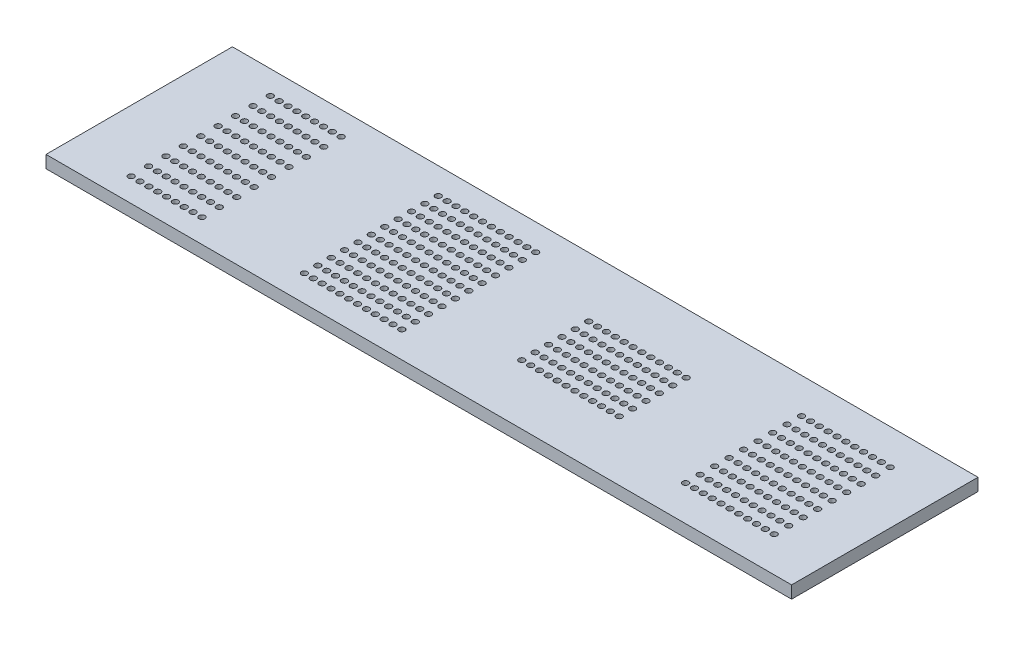
from build123d import *

# Parameters (mm, degrees)
ESQUISSE2_W                     = 120
ESQUISSE2_H                     = 30
BOSS_EXTRU_1_DEPTH              = 2
ENL_V_MAT_EXTRU_3_REACH         = 63.879
ESQUISSE8_R                     = 0.475
R_P_TITION_LIN_AIRE4_COUNT      = 9
R_P_TITION_LIN_AIRE4_PITCH      = 1.424
R_P_TITION_LIN_AIRE4_COUNT_DIR2 = 9
R_P_TITION_LIN_AIRE4_PITCH_DIR2 = 2.8
ENL_V_MAT_EXTRU_4_REACH         = 63.879
ESQUISSE10_R                    = 0.475
R_P_TITION_LIN_AIRE5_COUNT      = 12
R_P_TITION_LIN_AIRE5_PITCH      = 1.425
R_P_TITION_LIN_AIRE5_COUNT_DIR2 = 11
R_P_TITION_LIN_AIRE5_PITCH_DIR2 = 2.154
ENL_V_MAT_EXTRU_5_REACH         = 63.879
ESQUISSE12_R                    = 0.475
R_P_TITION_LIN_AIRE6_COUNT      = 12
R_P_TITION_LIN_AIRE6_PITCH      = 1.425
R_P_TITION_LIN_AIRE6_COUNT_DIR2 = 6
R_P_TITION_LIN_AIRE6_PITCH_DIR2 = 2.154
ENL_V_MAT_EXTRU_6_REACH         = 63.879
ESQUISSE14_R                    = 0.475
R_P_TITION_LIN_AIRE7_COUNT      = 11
R_P_TITION_LIN_AIRE7_PITCH      = 1.425
R_P_TITION_LIN_AIRE7_COUNT_DIR2 = 9
R_P_TITION_LIN_AIRE7_PITCH_DIR2 = 2.333


with BuildPart() as part:
    # Esquisse2 → Boss.-Extru.1 (new body)
    with BuildSketch(Plane(origin=(0, 0, 0), x_dir=(1, 0, 0), z_dir=(0, 1, 0))):
        Rectangle(ESQUISSE2_W, ESQUISSE2_H)
    extrude(amount=BOSS_EXTRU_1_DEPTH)

    # Esquisse8 → Enlèv. mat.-Extru.3 (cut, up to next)
    with BuildSketch(Plane(origin=(0, 2, 0), x_dir=(1, 0, 0), z_dir=(0, 1, 0)), mode=Mode.PRIVATE) as enl_v_mat_extru_3_sk1:
        with Locations(Location((-50.096, 11.2, 0), (0, 0, 270))):
            Circle(ESQUISSE8_R)
    enl_v_mat_extru_3_tool1 = extrude(enl_v_mat_extru_3_sk1.sketch, amount=-ENL_V_MAT_EXTRU_3_REACH, mode=Mode.PRIVATE) & part.part
    enl_v_mat_extru_3 = enl_v_mat_extru_3_tool1.solids().sort_by_distance((-50.096, 2, -11.2))[0]
    add(enl_v_mat_extru_3, mode=Mode.SUBTRACT)

    # Répétition linéaire4: Enl_v. mat.-Extru.3 9 × 9
    with Locations(*[(i * R_P_TITION_LIN_AIRE4_PITCH, 0, j * R_P_TITION_LIN_AIRE4_PITCH_DIR2) for i in range(R_P_TITION_LIN_AIRE4_COUNT) for j in range(R_P_TITION_LIN_AIRE4_COUNT_DIR2) if (i, j) != (0, 0)]):
        add(enl_v_mat_extru_3, mode=Mode.SUBTRACT)

    # Esquisse10 → Enlèv. mat.-Extru.4 (cut, up to next)
    with BuildSketch(Plane(origin=(0, 2, 0), x_dir=(1, 0, 0), z_dir=(0, 1, 0)), mode=Mode.PRIVATE) as enl_v_mat_extru_4_sk1:
        with Locations(Location((-22.6375, 10.77, 0), (0, 0, 270))):
            Circle(ESQUISSE10_R)
    enl_v_mat_extru_4_tool1 = extrude(enl_v_mat_extru_4_sk1.sketch, amount=-ENL_V_MAT_EXTRU_4_REACH, mode=Mode.PRIVATE) & part.part
    enl_v_mat_extru_4 = enl_v_mat_extru_4_tool1.solids().sort_by_distance((-22.6375, 2, -10.77))[0]
    add(enl_v_mat_extru_4, mode=Mode.SUBTRACT)

    # Répétition linéaire5: Enl_v. mat.-Extru.4 12 × 11
    with Locations(*[(i * R_P_TITION_LIN_AIRE5_PITCH, 0, j * R_P_TITION_LIN_AIRE5_PITCH_DIR2) for i in range(R_P_TITION_LIN_AIRE5_COUNT) for j in range(R_P_TITION_LIN_AIRE5_COUNT_DIR2) if (i, j) != (0, 0)]):
        add(enl_v_mat_extru_4, mode=Mode.SUBTRACT)

    # Esquisse12 → Enlèv. mat.-Extru.5 (cut, up to next)
    with BuildSketch(Plane(origin=(0, 2, 0), x_dir=(1, 0, 0), z_dir=(0, 1, 0)), mode=Mode.PRIVATE) as enl_v_mat_extru_5_sk1:
        with Locations(Location((6.9625, 5.385, 0), (0, 0, 270))):
            Circle(ESQUISSE12_R)
    enl_v_mat_extru_5_tool1 = extrude(enl_v_mat_extru_5_sk1.sketch, amount=-ENL_V_MAT_EXTRU_5_REACH, mode=Mode.PRIVATE) & part.part
    enl_v_mat_extru_5 = enl_v_mat_extru_5_tool1.solids().sort_by_distance((6.9625, 2, -5.385))[0]
    add(enl_v_mat_extru_5, mode=Mode.SUBTRACT)

    # Répétition linéaire6: Enl_v. mat.-Extru.5 12 × 6
    with Locations(*[(i * R_P_TITION_LIN_AIRE6_PITCH, 0, j * R_P_TITION_LIN_AIRE6_PITCH_DIR2) for i in range(R_P_TITION_LIN_AIRE6_COUNT) for j in range(R_P_TITION_LIN_AIRE6_COUNT_DIR2) if (i, j) != (0, 0)]):
        add(enl_v_mat_extru_5, mode=Mode.SUBTRACT)

    # Esquisse14 → Enlèv. mat.-Extru.6 (cut, up to next)
    with BuildSketch(Plane(origin=(0, 2, 0), x_dir=(1, 0, 0), z_dir=(0, 1, 0)), mode=Mode.PRIVATE) as enl_v_mat_extru_6_sk1:
        with Locations(Location((37.275, 9.332, 0), (0, 0, 270))):
            Circle(ESQUISSE14_R)
    enl_v_mat_extru_6_tool1 = extrude(enl_v_mat_extru_6_sk1.sketch, amount=-ENL_V_MAT_EXTRU_6_REACH, mode=Mode.PRIVATE) & part.part
    enl_v_mat_extru_6 = enl_v_mat_extru_6_tool1.solids().sort_by_distance((37.275, 2, -9.332))[0]
    add(enl_v_mat_extru_6, mode=Mode.SUBTRACT)

    # Répétition linéaire7: Enl_v. mat.-Extru.6 11 × 9
    with Locations(*[(i * R_P_TITION_LIN_AIRE7_PITCH, 0, j * R_P_TITION_LIN_AIRE7_PITCH_DIR2) for i in range(R_P_TITION_LIN_AIRE7_COUNT) for j in range(R_P_TITION_LIN_AIRE7_COUNT_DIR2) if (i, j) != (0, 0)]):
        add(enl_v_mat_extru_6, mode=Mode.SUBTRACT)


solid = part.part
